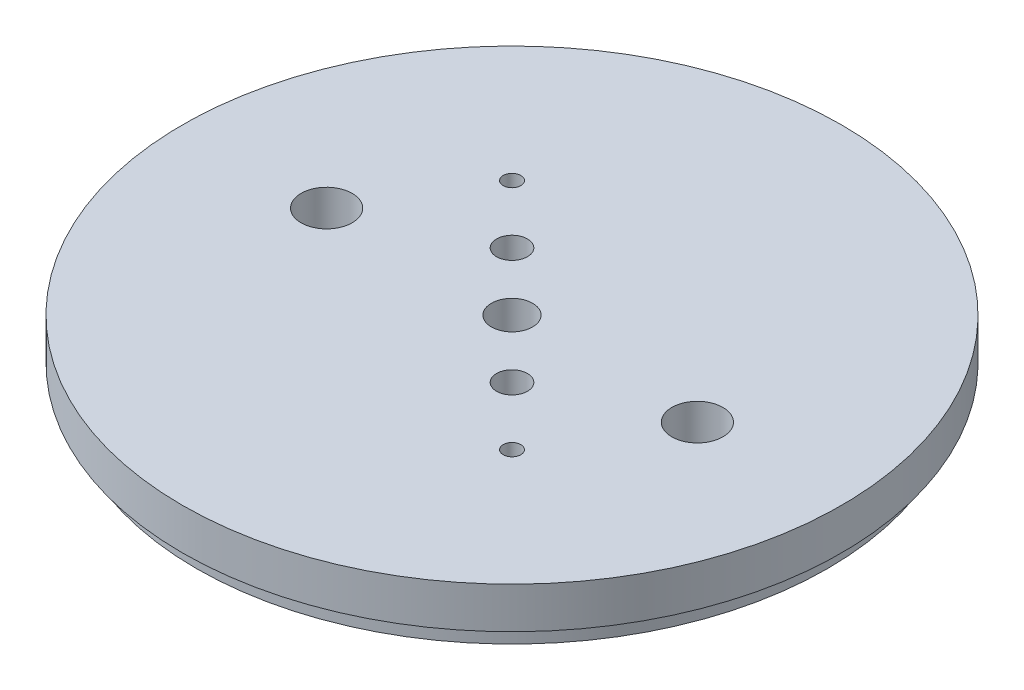
from build123d import *

# Parameters (mm, degrees)
SKETCH1_R           = 50.8
SKETCH1_R_2         = 3.175
SKETCH1_R_3         = 3.937
SKETCH1_R_4         = 1.3589
SKETCH1_R_5         = 2.38125
BOSS_EXTRUDE1_DEPTH = 9.525
SKETCH2_R           = 50.8
SKETCH2_R_2         = 48.641
CUT_EXTRUDE1_DEPTH  = 3.175
CUT_EXTRUDE2_START  = -5.969
CUT_EXTRUDE2_DEPTH  = 3.556


with BuildPart() as part:
    # Sketch1 → Boss-Extrude1 (new body)
    with BuildSketch(Plane(origin=(0, 0, 0), x_dir=(1, 0, 0), z_dir=(0, 1, 0))):
        Circle(SKETCH1_R)
        Circle(SKETCH1_R_2, mode=Mode.SUBTRACT)
        with Locations((28.575, 0)):
            Circle(SKETCH1_R_3, mode=Mode.SUBTRACT)
        with Locations((-28.575, 0)):
            Circle(SKETCH1_R_3, mode=Mode.SUBTRACT)
        with Locations((-17.960512242, 17.960512242)):
            Circle(SKETCH1_R_4, mode=Mode.SUBTRACT)
        with Locations((17.960512242, -17.960512242)):
            Circle(SKETCH1_R_4, mode=Mode.SUBTRACT)
        with Locations((-8.980256121, 8.980256121)):
            Circle(SKETCH1_R_5, mode=Mode.SUBTRACT)
        with Locations((8.980256121, -8.980256121)):
            Circle(SKETCH1_R_5, mode=Mode.SUBTRACT)
    extrude(amount=BOSS_EXTRUDE1_DEPTH)

    # Sketch2 → Cut-Extrude1 (cut)
    with BuildSketch(Plane.XZ):
        Circle(SKETCH2_R)
        Circle(SKETCH2_R_2, mode=Mode.SUBTRACT)
    extrude(amount=-CUT_EXTRUDE1_DEPTH, mode=Mode.SUBTRACT)

    # Sketch3 → Cut-Extrude2 (cut)
    with BuildSketch(Plane(origin=(0, 9.525, 0), x_dir=(1, 0, 0), z_dir=(0, 1, 0)).offset(CUT_EXTRUDE2_START)):
        with BuildLine():
            Line((3.2385, 34.798), (3.2385, 13.97))
            ThreePointArc((3.2385, 13.97), (0, 10.7315), (-3.2385, 13.97))
            Line((-3.2385, 13.97), (-3.2385, 34.798))
            ThreePointArc((-3.2385, 34.798), (0, 38.0365), (3.2385, 34.798))
        make_face()
        with BuildLine():
            Line((3.2385, -34.798), (3.2385, -13.97))
            ThreePointArc((3.2385, -13.97), (0, -10.7315), (-3.2385, -13.97))
            Line((-3.2385, -13.97), (-3.2385, -34.798))
            ThreePointArc((-3.2385, -34.798), (0, -38.0365), (3.2385, -34.798))
        make_face()
    extrude(amount=-CUT_EXTRUDE2_DEPTH, mode=Mode.SUBTRACT)


solid = part.part
